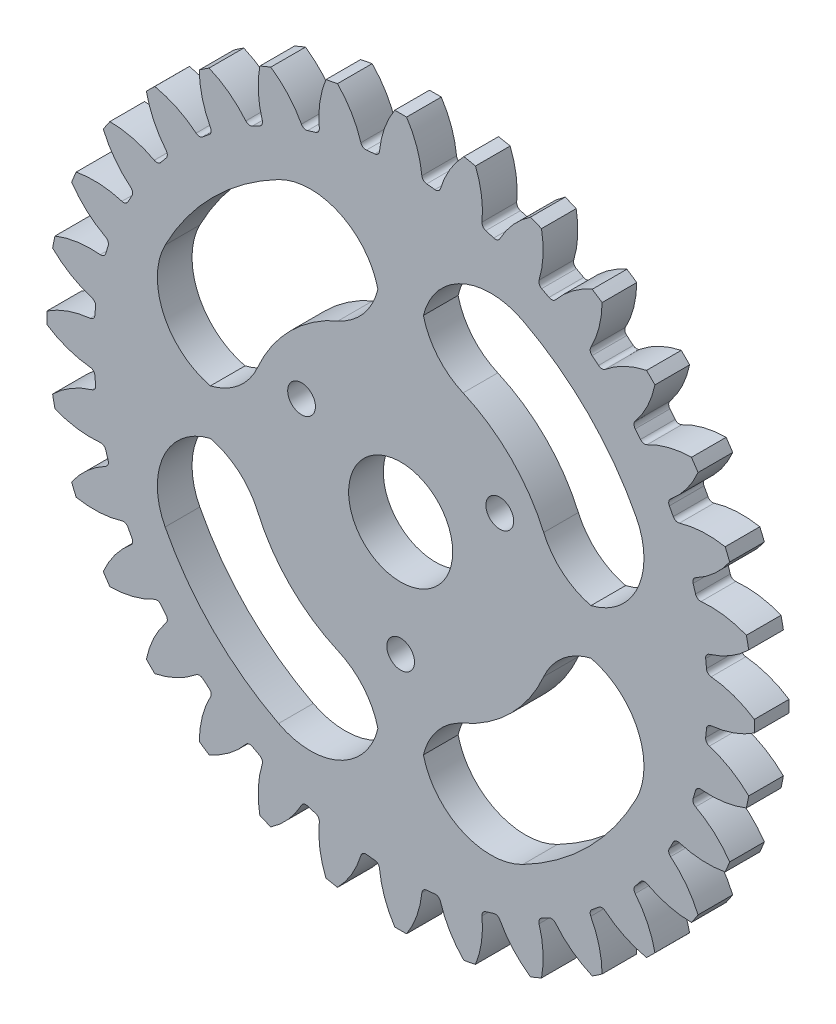
from build123d import *

# Parameters (mm, degrees)
SKETCH_1_R                       = 44.25
EXTRUDE_1_DEPTH                  = 5
EXTRUDE_2_DEPTH                  = 5
FILLET_1_R                       = 0.75
CUT_EXTRUDE_1_REACH              = 69.706
SKETCH_3_R                       = 7.5
SKETCH_3_R_2                     = 2
FILLET_2_R                       = 10
PATTERN_CIRCULAR_1_COUNT         = 32
FILLET_1_OF_PATTERN_CIRCULAR_1_R = 0.75


with BuildPart() as part:
    # 스케치1 → 보스-돌출1 (new body)
    with BuildSketch(Plane.XY):
        Circle(SKETCH_1_R)
    extrude(amount=EXTRUDE_1_DEPTH)

    # 스케치1<3> → 보스-돌출2 (add)
    with BuildSketch(Plane.XY):
        with BuildLine():
            ThreePointArc((3.105, 44.140927437), (2.43170766, 47.715209886), (0.855, 50.992832585))
            ThreePointArc((0.855, 50.992832585), (0, 51), (-0.855, 50.992832585))
            ThreePointArc((-0.855, 50.992832585), (-2.43170766, 47.715209886), (-3.105, 44.140927437))
            ThreePointArc((-3.105, 44.140927437), (0, 44.25), (3.105, 44.140927437))
        make_face()
    extrude_2 = extrude(amount=EXTRUDE_2_DEPTH)

    # 필렛1
    fillet_1_edges = [part.edges().sort_by_distance(p)[0] for p in [
        (-3.105, 44.140927437, 2.5),
        (3.105, 44.140927437, 2.5),
    ]]
    fillet(fillet_1_edges, radius=FILLET_1_R)

    # 스케치3 → 컷-돌출1 (cut, up to next)
    with BuildSketch(Plane.XY.offset(5), mode=Mode.PRIVATE) as cut_extrude_1_sk1:
        Circle(SKETCH_3_R)
    cut_extrude_1_tool1 = extrude(cut_extrude_1_sk1.sketch, amount=-CUT_EXTRUDE_1_REACH, mode=Mode.PRIVATE) & part.part
    # 스케치3 → 컷-돌출1 (cut, up to next)
    with BuildSketch(Plane.XY.offset(5), mode=Mode.PRIVATE) as cut_extrude_1_sk2:
        with BuildLine():
            ThreePointArc((38.132171457, 3), (27.04683438, 27.04683438), (3, 38.132171457))
            Line((3, 38.132171457), (3, 22.299103121))
            ThreePointArc((3, 22.299103121), (15.909902577, 15.909902577), (22.299103121, 3))
            Line((22.299103121, 3), (38.132171457, 3))
        make_face()
    cut_extrude_1_tool2 = extrude(cut_extrude_1_sk2.sketch, amount=-CUT_EXTRUDE_1_REACH, mode=Mode.PRIVATE) & part.part
    # 스케치3 → 컷-돌출1 (cut, up to next)
    with BuildSketch(Plane.XY.offset(5), mode=Mode.PRIVATE) as cut_extrude_1_sk3:
        with BuildLine():
            Line((-3, 22.299103121), (-3, 38.132171457))
            ThreePointArc((-3, 38.132171457), (-27.04683438, 27.04683438), (-38.132171457, 3))
            Line((-38.132171457, 3), (-22.299103121, 3))
            ThreePointArc((-22.299103121, 3), (-15.909902577, 15.909902577), (-3, 22.299103121))
        make_face()
    cut_extrude_1_tool3 = extrude(cut_extrude_1_sk3.sketch, amount=-CUT_EXTRUDE_1_REACH, mode=Mode.PRIVATE) & part.part
    # 스케치3 → 컷-돌출1 (cut, up to next)
    with BuildSketch(Plane.XY.offset(5), mode=Mode.PRIVATE) as cut_extrude_1_sk4:
        with BuildLine():
            Line((-22.299103121, -3), (-38.132171457, -3))
            ThreePointArc((-38.132171457, -3), (-27.04683438, -27.04683438), (-3, -38.132171457))
            Line((-3, -38.132171457), (-3, -22.299103121))
            ThreePointArc((-3, -22.299103121), (-15.909902577, -15.909902577), (-22.299103121, -3))
        make_face()
    cut_extrude_1_tool4 = extrude(cut_extrude_1_sk4.sketch, amount=-CUT_EXTRUDE_1_REACH, mode=Mode.PRIVATE) & part.part
    # 스케치3 → 컷-돌출1 (cut, up to next)
    with BuildSketch(Plane.XY.offset(5), mode=Mode.PRIVATE) as cut_extrude_1_sk5:
        with BuildLine():
            ThreePointArc((3, -38.132171457), (27.04683438, -27.04683438), (38.132171457, -3))
            Line((38.132171457, -3), (22.299103121, -3))
            ThreePointArc((22.299103121, -3), (15.909902577, -15.909902577), (3, -22.299103121))
            Line((3, -22.299103121), (3, -38.132171457))
        make_face()
    cut_extrude_1_tool5 = extrude(cut_extrude_1_sk5.sketch, amount=-CUT_EXTRUDE_1_REACH, mode=Mode.PRIVATE) & part.part
    # 스케치3 → 컷-돌출1 (cut, up to next)
    with BuildSketch(Plane.XY.offset(5), mode=Mode.PRIVATE) as cut_extrude_1_sk6:
        with Locations((14.289419162, 8.25)):
            Circle(SKETCH_3_R_2)
    cut_extrude_1_tool6 = extrude(cut_extrude_1_sk6.sketch, amount=-CUT_EXTRUDE_1_REACH, mode=Mode.PRIVATE) & part.part
    # 스케치3 → 컷-돌출1 (cut, up to next)
    with BuildSketch(Plane.XY.offset(5), mode=Mode.PRIVATE) as cut_extrude_1_sk7:
        with Locations((-14.289419162, 8.25)):
            Circle(SKETCH_3_R_2)
    cut_extrude_1_tool7 = extrude(cut_extrude_1_sk7.sketch, amount=-CUT_EXTRUDE_1_REACH, mode=Mode.PRIVATE) & part.part
    # 스케치3 → 컷-돌출1 (cut, up to next)
    with BuildSketch(Plane.XY.offset(5), mode=Mode.PRIVATE) as cut_extrude_1_sk8:
        with Locations((0, -16.5)):
            Circle(SKETCH_3_R_2)
    cut_extrude_1_tool8 = extrude(cut_extrude_1_sk8.sketch, amount=-CUT_EXTRUDE_1_REACH, mode=Mode.PRIVATE) & part.part
    add(cut_extrude_1_tool1.solids().sort_by_distance((0, 0, 5))[0], mode=Mode.SUBTRACT)
    add(cut_extrude_1_tool2.solids().sort_by_distance((20.326771, 20.326771, 5))[0], mode=Mode.SUBTRACT)
    add(cut_extrude_1_tool3.solids().sort_by_distance((-20.326771, 20.326771, 5))[0], mode=Mode.SUBTRACT)
    add(cut_extrude_1_tool4.solids().sort_by_distance((-20.326771, -20.326771, 5))[0], mode=Mode.SUBTRACT)
    add(cut_extrude_1_tool5.solids().sort_by_distance((20.326771, -20.326771, 5))[0], mode=Mode.SUBTRACT)
    add(cut_extrude_1_tool6.solids().sort_by_distance((14.289419, 8.25, 5))[0], mode=Mode.SUBTRACT)
    add(cut_extrude_1_tool7.solids().sort_by_distance((-14.289419, 8.25, 5))[0], mode=Mode.SUBTRACT)
    add(cut_extrude_1_tool8.solids().sort_by_distance((0, -16.5, 5))[0], mode=Mode.SUBTRACT)

    # 필렛2
    # the kernel refuses this fillet: 10 mm, written as the material it adds along each edge
    with BuildSketch(Plane(origin=(-3, 38.132171457, 5), x_dir=(0, -1, 0), z_dir=(0, 0, -1))) as fillet_2_piece_1:
        with BuildLine():
            CenterArc((13.051053061, 10), FILLET_2_R, 152.601470993, 117.398529007)
            ThreePointArc((4.172781062, 14.601769912), (1.354443907, 7.51005501), (0, 0))
            Line((0, 0), (13.051053061, 0))
        make_face()
    extrude(amount=5)
    with BuildSketch(Plane(origin=(-38.132171457, 3, 5), x_dir=(0.27477268000757343, 0.9615092169716605, 0), z_dir=(0, 0, -1)), Plane(origin=(-3, -38.132171457, 5), x_dir=(-0.9615092169716605, 0.27477268000757316, 0), z_dir=(0, 0, -1)), Plane(origin=(38.132171457, -3, 5), x_dir=(-0.27477268000757404, -0.9615092169716603, 0), z_dir=(0, 0, -1)), Plane(origin=(3, 38.132171457, 5), x_dir=(0.9615092169716604, -0.2747726800075735, 0), z_dir=(0, 0, -1))) as fillet_2_piece_2:
        with BuildLine():
            CenterArc((13.201164996, 9.800981009), FILLET_2_R, 164.051532162, 117.398529007)
            Line((3.586072826, 12.548707809), (0, 0))
            ThreePointArc((0, 0), (7.593151295, -0.761247641), (15.186302589, 0))
        make_face()
    extrude(amount=5)
    with BuildSketch(Plane(origin=(-38.132171457, -3, 5), x_dir=(0.2747726800075736, -0.9615092169716604, 0), z_dir=(0, 0, -1)), Plane(origin=(3, -38.132171457, 5), x_dir=(0.9615092169716601, 0.2747726800075743, 0), z_dir=(0, 0, -1)), Plane(origin=(38.132171457, 3, 5), x_dir=(-0.27477268000757343, 0.9615092169716605, 0), z_dir=(0, 0, -1))) as fillet_2_piece_3:
        with BuildLine():
            CenterArc((13.201164996, -9.800981009), FILLET_2_R, 78.549938831, 117.398529007)
            Line((3.586072826, -12.548707809), (0, 0))
            ThreePointArc((0, 0), (7.593151295, 0.761247641), (15.186302589, 0))
        make_face()
    extrude(amount=5)
    with BuildSketch(Plane(origin=(-22.299103121, -3, 5), x_dir=(0.26925966004330776, -0.9630676172903762, 0), z_dir=(0, 0, -1)), Plane(origin=(3, -22.299103121, 5), x_dir=(0.9630676172903765, 0.26925966004330654, 0), z_dir=(0, 0, -1)), Plane(origin=(22.299103121, 3, 5), x_dir=(-0.26925966004330704, 0.9630676172903764, 0), z_dir=(0, 0, -1)), Plane(origin=(-3, 22.299103121, 5), x_dir=(-0.9630676172903762, -0.26925966004330704, 0), z_dir=(0, 0, -1))) as fillet_2_piece_4:
        with BuildLine():
            CenterArc((7.614557069, 9.903699151), FILLET_2_R, 195.620217069, 66.421821522)
            Line((-2.016119104, 7.211102551), (0, 0))
            ThreePointArc((0, 0), (3.115046074, 0.216676909), (6.230092148, 0))
        make_face()
    extrude(amount=5)
    with BuildSketch(Plane(origin=(-3, -22.299103121, 5), x_dir=(0, -1, 0), z_dir=(0, 0, -1)), Plane(origin=(22.299103121, -3, 5), x_dir=(1, 0, 0), z_dir=(0, 0, -1)), Plane(origin=(3, 22.299103121, 5), x_dir=(0, 1, 0), z_dir=(0, 0, -1))) as fillet_2_piece_5:
        with BuildLine():
            CenterArc((7.487638896, 10), FILLET_2_R, 203.578178478, 66.421821522)
            ThreePointArc((-1.677512494, 6), (-0.630081732, 3.058342351), (0, 0))
            Line((0, 0), (7.487638896, 0))
        make_face()
    extrude(amount=5)
    with BuildSketch(Plane(origin=(-22.299103121, 3, 5), x_dir=(0.26925966004330654, 0.9630676172903765, 0), z_dir=(0, 0, -1))) as fillet_2_piece_6:
        with BuildLine():
            CenterArc((7.614557069, -9.903699151), FILLET_2_R, 97.957961409, 66.421821522)
            Line((-2.016119104, -7.211102551), (0, 0))
            ThreePointArc((0, 0), (3.115046074, -0.216676909), (6.230092148, 0))
        make_face()
    extrude(amount=5)

    # 원형 패턴1: 보스-돌출2 ×32 about axis
    pattern_circular_1_axis = Axis((0, 0, 0), (0, 0, 1))
    for i in range(1, PATTERN_CIRCULAR_1_COUNT):
        add(extrude_2.rotate(pattern_circular_1_axis, i * 360 / PATTERN_CIRCULAR_1_COUNT))

    # 필렛1 of 원형 패턴1
    fillet_1_of_pattern_circular_1_edges = [part.edges().sort_by_distance(p)[0] for p in [
        (-11.656806043, 42.687016444, 2.5),
        (-5.566129452, 43.898527343, 2.5),
        (-19.760647568, 39.592667348, 2.5),
        (-14.023355671, 41.969131463, 2.5),
        (-27.105098488, 34.976794249, 2.5),
        (-21.941672196, 38.426885396, 2.5),
        (-33.407915674, 29.016782563, 2.5),
        (-29.016782563, 33.407915674, 2.5),
        (-38.426885396, 21.941672196, 2.5),
        (-34.976794249, 27.105098488, 2.5),
        (-41.969131463, 14.023355671, 2.5),
        (-39.592667348, 19.760647568, 2.5),
        (-43.898527343, 5.566129452, 2.5),
        (-42.687016444, 11.656806043, 2.5),
        (-44.140927437, -3.105, 2.5),
        (-44.140927437, 3.105, 2.5),
        (-42.687016444, -11.656806043, 2.5),
        (-43.898527343, -5.566129452, 2.5),
        (-39.592667348, -19.760647568, 2.5),
        (-41.969131463, -14.023355671, 2.5),
        (-34.976794249, -27.105098488, 2.5),
        (-38.426885396, -21.941672196, 2.5),
        (-29.016782563, -33.407915674, 2.5),
        (-33.407915674, -29.016782563, 2.5),
        (-21.941672196, -38.426885396, 2.5),
        (-27.105098488, -34.976794249, 2.5),
        (-14.023355671, -41.969131463, 2.5),
        (-19.760647568, -39.592667348, 2.5),
        (-5.566129452, -43.898527343, 2.5),
        (-11.656806043, -42.687016444, 2.5),
        (3.105, -44.140927437, 2.5),
        (-3.105, -44.140927437, 2.5),
        (11.656806043, -42.687016444, 2.5),
        (5.566129452, -43.898527343, 2.5),
        (19.760647568, -39.592667348, 2.5),
        (14.023355671, -41.969131463, 2.5),
        (27.105098488, -34.976794249, 2.5),
        (21.941672196, -38.426885396, 2.5),
        (33.407915674, -29.016782563, 2.5),
        (29.016782563, -33.407915674, 2.5),
        (38.426885396, -21.941672196, 2.5),
        (34.976794249, -27.105098488, 2.5),
        (41.969131463, -14.023355671, 2.5),
        (39.592667348, -19.760647568, 2.5),
        (43.898527343, -5.566129452, 2.5),
        (42.687016444, -11.656806043, 2.5),
        (44.140927437, 3.105, 2.5),
        (44.140927437, -3.105, 2.5),
        (42.687016444, 11.656806043, 2.5),
        (43.898527343, 5.566129452, 2.5),
        (39.592667348, 19.760647568, 2.5),
        (41.969131463, 14.023355671, 2.5),
        (34.976794249, 27.105098488, 2.5),
        (38.426885396, 21.941672196, 2.5),
        (29.016782563, 33.407915674, 2.5),
        (33.407915674, 29.016782563, 2.5),
        (21.941672196, 38.426885396, 2.5),
        (27.105098488, 34.976794249, 2.5),
        (14.023355671, 41.969131463, 2.5),
        (19.760647568, 39.592667348, 2.5),
        (5.566129452, 43.898527343, 2.5),
        (11.656806043, 42.687016444, 2.5),
    ]]
    fillet(fillet_1_of_pattern_circular_1_edges, radius=FILLET_1_OF_PATTERN_CIRCULAR_1_R)


solid = part.part
